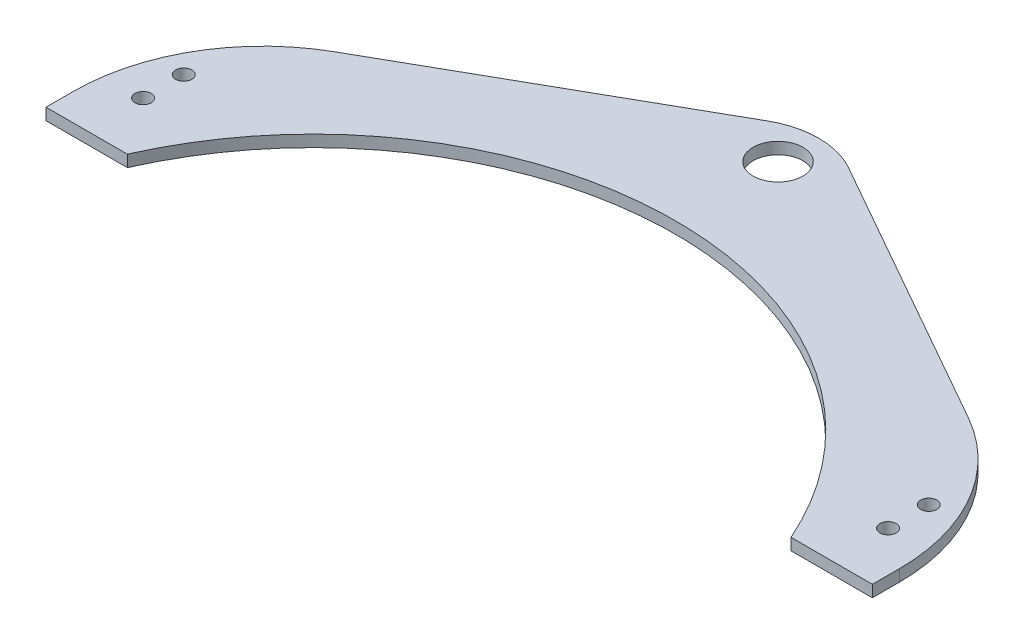
from build123d import *

# Parameters (mm, degrees)
SKETCH1_R           = 4.6
SKETCH1_R_2         = 1.5
BOSS_EXTRUDE2_DEPTH = 3.175
SKETCH2_W           = 235.965281387
SKETCH2_H           = 118.721671229
CUT_EXTRUDE1_DEPTH  = 1.016


with BuildPart() as part:
    # Sketch1 → Boss-Extrude2 (new body)
    with BuildSketch(Plane(origin=(0, 0, 0), x_dir=(1, 0, 0), z_dir=(0, 1, 0))):
        with BuildLine():
            Line((-7.5, 0), (0, 0))
            ThreePointArc((0, 0), (61.2, 39.907584028), (122.4, 0))
            Line((122.4, 0), (129.9, 0))
            Line((129.9, 0), (137.4, 0))
            Line((137.4, 0), (137.4, 5.001196831))
            ThreePointArc((137.4, 5.001196831), (132.638976527, 22.625166265), (119.651182936, 35.45438529))
            Line((119.651182936, 35.45438529), (68.639886063, 64.351366482))
            ThreePointArc((68.639886063, 64.351366482), (65.069446402, 65.804662996), (61.246521948, 66.3))
            Line((61.246521948, 66.3), (61.153478052, 66.3))
            ThreePointArc((61.153478052, 66.3), (57.330553598, 65.804662996), (53.760113937, 64.351366482))
            Line((53.760113937, 64.351366482), (2.748817064, 35.45438529))
            ThreePointArc((2.748817064, 35.45438529), (-10.238976527, 22.625166265), (-15, 5.001196831))
            Line((-15, 5.001196831), (-15, 0))
            Line((-15, 0), (-7.5, 0))
        make_face()
        with Locations((61.2, 58.8)):
            Circle(SKETCH1_R, mode=Mode.SUBTRACT)
        with BuildLine():
            ThreePointArc((-7.5, 8.9), (-9, 10.4), (-7.5, 11.9))
            ThreePointArc((-7.5, 11.9), (-6, 10.4), (-7.5, 8.9))
        make_face(mode=Mode.SUBTRACT)
        with Locations((-7.5, 17.9)):
            Circle(SKETCH1_R_2, mode=Mode.SUBTRACT)
        with BuildLine():
            ThreePointArc((129.9, 8.9), (128.4, 10.4), (129.9, 11.9))
            ThreePointArc((129.9, 11.9), (131.4, 10.4), (129.9, 8.9))
        make_face(mode=Mode.SUBTRACT)
        with Locations((129.9, 17.9)):
            Circle(SKETCH1_R_2, mode=Mode.SUBTRACT)
    extrude(amount=BOSS_EXTRUDE2_DEPTH)

    # Sketch2 → Cut-Extrude1 (cut)
    with BuildSketch(Plane(origin=(0, 3.175, 0), x_dir=(1, 0, 0), z_dir=(0, 1, 0))):
        with Locations((50.311488443, 30.817995662)):
            Rectangle(SKETCH2_W, SKETCH2_H)
    extrude(amount=-CUT_EXTRUDE1_DEPTH, mode=Mode.SUBTRACT)


solid = part.part
